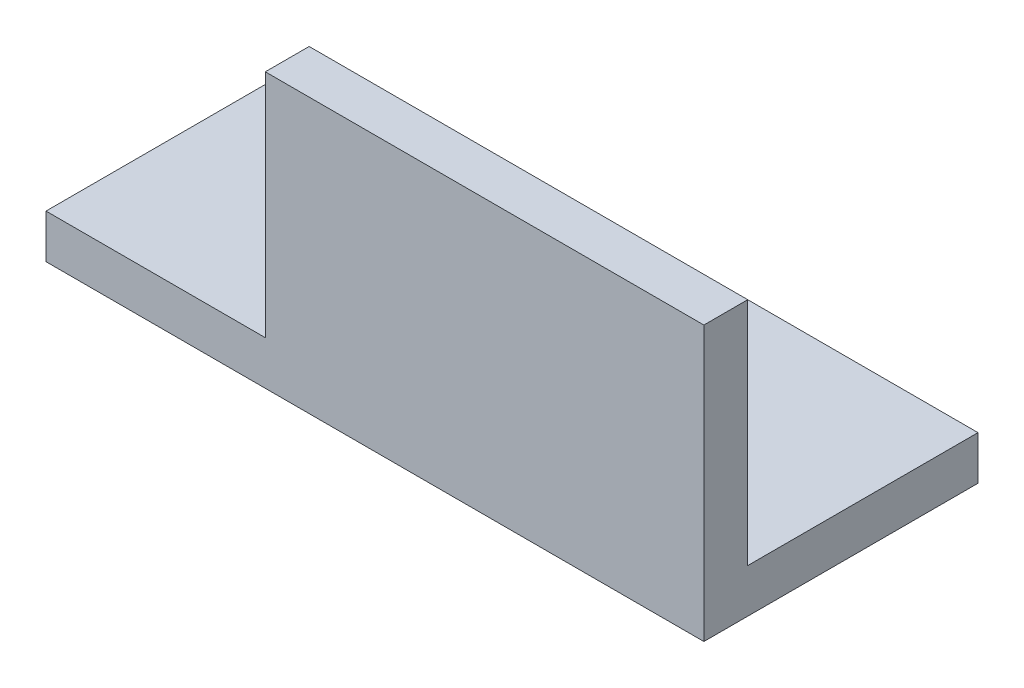
from build123d import *

# Parameters (mm, degrees)
EXTRUDE_1_DEPTH     = 60
SKETCH_2_W          = 20
SKETCH_2_H          = 21
CUT_EXTRUDE_1_DEPTH = 70.641941386


with BuildPart() as part:
    # Эскиз1 → Вытянуть-Тонкостенный1 (new body)
    with BuildSketch(Plane(origin=(0, 0, 0), x_dir=(0, 0, -1), z_dir=(1, 0, 0))):
        Polygon((0, 25), (0, 0), (25, 0), (25, 4), (4, 4), (4, 25), align=None)
    extrude(amount=EXTRUDE_1_DEPTH)

    # Эскиз2 → Вырез-Вытянуть1 (cut, through all)
    with BuildSketch(Plane.XY):
        with Locations((10, 14.5)):
            Rectangle(SKETCH_2_W, SKETCH_2_H)
    extrude(amount=-CUT_EXTRUDE_1_DEPTH, mode=Mode.SUBTRACT)


solid = part.part
